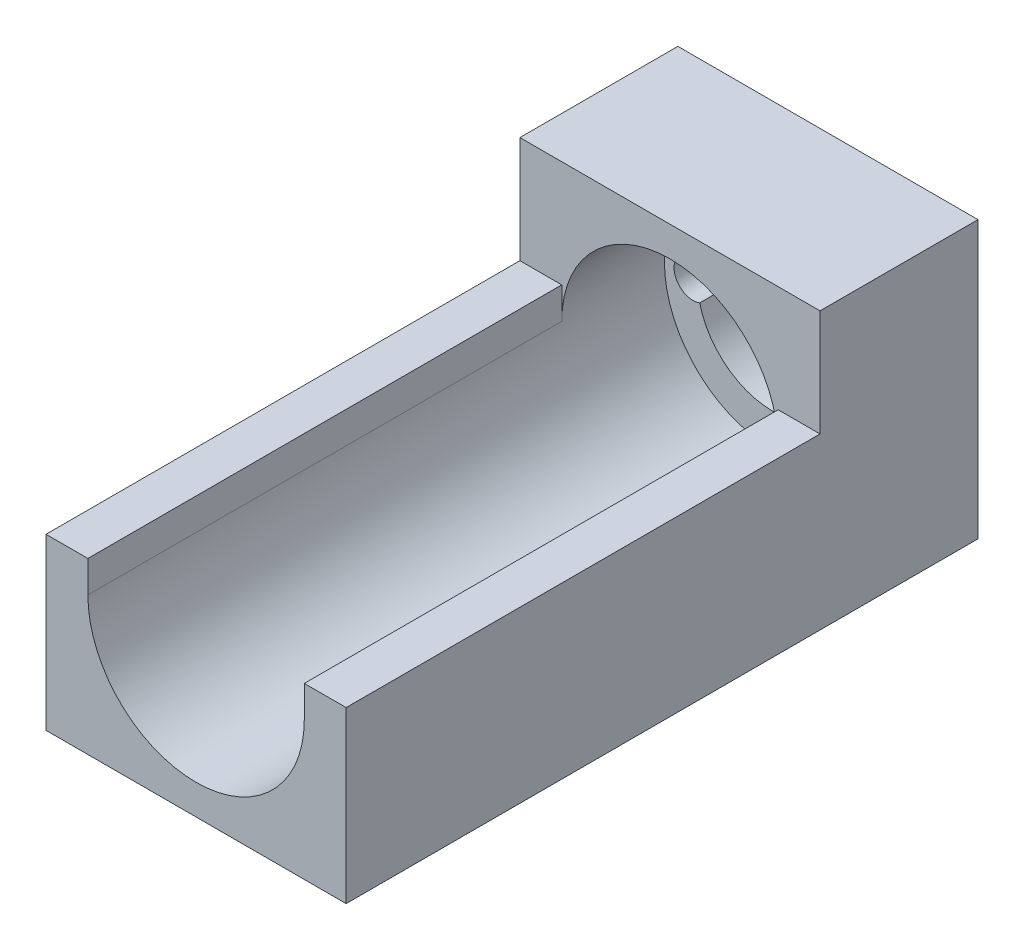
from build123d import *

# Parameters (mm, degrees)
CROQUIS1_R              = 13.7
SALIENTE_EXTRUIR1_DEPTH = 5
CROQUIS2_R              = 9.5
CORTAR_EXTRUIR1_DEPTH   = 3.5
CROQUIS3_R              = 6.8
CORTAR_EXTRUIR2_DEPTH   = 3
SALIENTE_EXTRUIR2_START = 2
CROQUIS4_R              = 13.7
CROQUIS4_R_2            = 6.65
SALIENTE_EXTRUIR2_DEPTH = 2
CROQUIS5_R              = 1.25
CORTAR_EXTRUIR3_DEPTH   = 21.600485431
CROQUIS6_W              = 38
CROQUIS6_H              = 35
CROQUIS6_R              = 13.7
SALIENTE_EXTRUIR3_DEPTH = 20
SALIENTE_EXTRUIR5_DEPTH = 60


with BuildPart() as part:
    # Croquis1 → Saliente-Extruir1 (new body)
    with BuildSketch(Plane.XY):
        Circle(CROQUIS1_R)
        with BuildLine():
            Line((0, 0.75), (7.800197377, 0.75))
            ThreePointArc((7.800197377, 0.75), (10.459785271, 2.369760146), (12.48, 0))
            ThreePointArc((12.48, 0), (10.459785271, -2.369760146), (7.800197377, -0.75))
            Line((7.800197377, -0.75), (0, -0.75))
            Line((0, -0.75), (-7.800197377, -0.75))
            ThreePointArc((-7.800197377, -0.75), (-12.48, 0), (-7.800197377, 0.75))
            Line((-7.800197377, 0.75), (0, 0.75))
        make_face(mode=Mode.SUBTRACT)
    extrude(amount=SALIENTE_EXTRUIR1_DEPTH)

    # Croquis2 → Cortar-Extruir1 (cut)
    with BuildSketch(Plane.XY.offset(5)):
        Circle(CROQUIS2_R)
    extrude(amount=-CORTAR_EXTRUIR1_DEPTH, mode=Mode.SUBTRACT)

    # Croquis3 → Cortar-Extruir2 (cut)
    with BuildSketch(Plane.XY.offset(1.5)):
        Circle(CROQUIS3_R)
    extrude(amount=-CORTAR_EXTRUIR2_DEPTH, mode=Mode.SUBTRACT)

    # Croquis4 → Saliente-Extruir2 (add)
    with BuildSketch(Plane(origin=(0, 0, 0), x_dir=(-1, 0, 0), z_dir=(0, 0, -1)).offset(SALIENTE_EXTRUIR2_START)):
        Circle(CROQUIS4_R)
        Circle(CROQUIS4_R_2, mode=Mode.SUBTRACT)
    extrude(amount=-SALIENTE_EXTRUIR2_DEPTH)

    # Croquis5 → Cortar-Extruir3 (cut, through all)
    with BuildSketch(Plane.XY.offset(5)):
        with Locations((-10.08, 0)):
            Circle(CROQUIS5_R)
        with Locations((10.08, 0)):
            Circle(CROQUIS5_R)
    extrude(amount=-CORTAR_EXTRUIR3_DEPTH, mode=Mode.SUBTRACT)


with BuildPart() as body_2:
    # Croquis6 → Saliente-Extruir3 (new body)
    with BuildSketch(Plane(origin=(0, 0, -2), x_dir=(-1, 0, 0), z_dir=(0, 0, -1))):
        Rectangle(CROQUIS6_W, CROQUIS6_H)
        Circle(CROQUIS6_R, mode=Mode.SUBTRACT)
    extrude(amount=-SALIENTE_EXTRUIR3_DEPTH)

    # Croquis8 → Saliente-Extruir5 (add)
    with BuildSketch(Plane.XY.offset(18)):
        with BuildLine():
            Line((-19, 4), (-19, -17.5))
            Line((-19, -17.5), (19, -17.5))
            Line((19, -17.5), (19, 4))
            Line((19, 4), (13.7, 4))
            Line((13.7, 4), (13.7, 0))
            ThreePointArc((13.7, 0), (0, -13.7), (-13.7, 0))
            Line((-13.7, 0), (-13.7, 4))
            Line((-13.7, 4), (-19, 4))
        make_face()
    extrude(amount=SALIENTE_EXTRUIR5_DEPTH)


solid = Compound([part.part, body_2.part])
